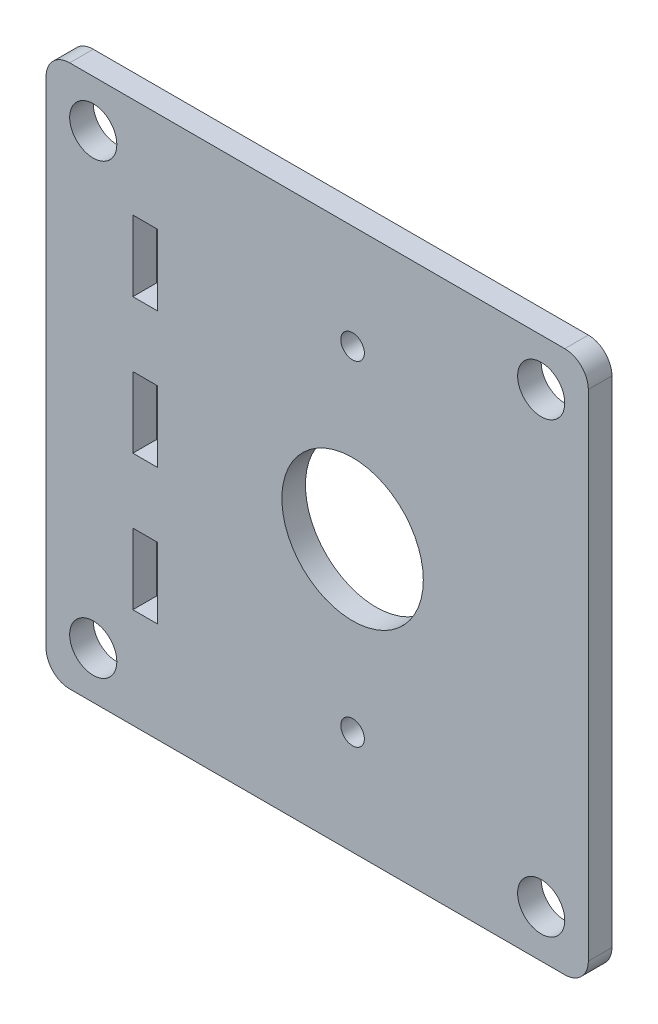
from build123d import *

# Parameters (mm, degrees)
SKETCH1_W           = 146.05
SKETCH1_H           = 146.05
SKETCH1_R           = 6.35
SKETCH1_R_2         = 19.05
SKETCH1_R_3         = 3.175
SKETCH1_W_2         = 6.604
SKETCH1_H_2         = 19.05
BOSS_EXTRUDE1_DEPTH = 3.175
FILLET1_R           = 6.35


with BuildPart() as part:
    # Sketch1 → Boss-Extrude1 (new, symmetric)
    with BuildSketch(Plane.XY):
        with Locations((-9.525, 0)):
            Rectangle(SKETCH1_W, SKETCH1_H)
        with Locations((50.8, 60.325)):
            Circle(SKETCH1_R, mode=Mode.SUBTRACT)
        with Locations((50.8, -60.325)):
            Circle(SKETCH1_R, mode=Mode.SUBTRACT)
        Circle(SKETCH1_R_2, mode=Mode.SUBTRACT)
        with Locations((0, 45)):
            Circle(SKETCH1_R_3, mode=Mode.SUBTRACT)
        with Locations((0, -45)):
            Circle(SKETCH1_R_3, mode=Mode.SUBTRACT)
        with Locations((-69.85, 60.325)):
            Circle(SKETCH1_R, mode=Mode.SUBTRACT)
        with Locations((-69.85, -60.325)):
            Circle(SKETCH1_R, mode=Mode.SUBTRACT)
        with Locations((-55.88, 0)):
            Rectangle(SKETCH1_W_2, SKETCH1_H_2, mode=Mode.SUBTRACT)
        with Locations((-55.88, 36.5125)):
            Rectangle(SKETCH1_W_2, SKETCH1_H_2, mode=Mode.SUBTRACT)
        with Locations((-55.88, -36.5125)):
            Rectangle(SKETCH1_W_2, SKETCH1_H_2, mode=Mode.SUBTRACT)
    extrude(amount=BOSS_EXTRUDE1_DEPTH, both=True)

    # Fillet1
    fillet1_edges = [part.edges().sort_by_distance(p)[0] for p in [
        (63.5, -73.025, 0),
        (-82.55, -73.025, 0),
        (-82.55, 73.025, 0),
        (63.5, 73.025, 0),
    ]]
    fillet(fillet1_edges, radius=FILLET1_R)


solid = part.part
